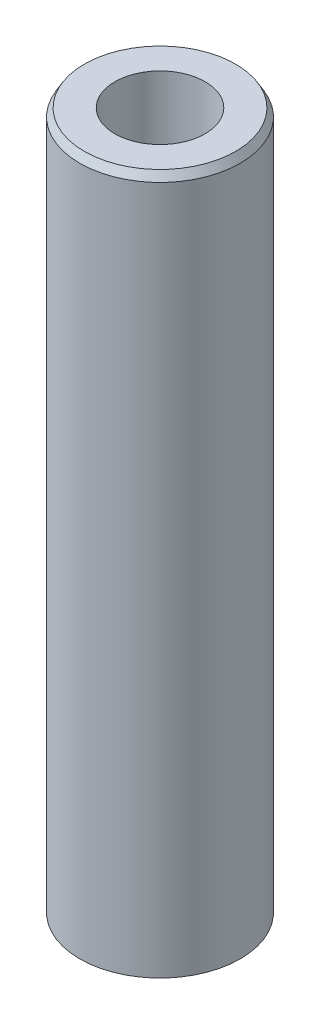
from build123d import *
from OCP.BRepFilletAPI import BRepFilletAPI_MakeChamfer

# Parameters (mm, degrees)
SKETCH1_R           = 40
BOSS_EXTRUDE1_DEPTH = 349.717740528
SKETCH2_R           = 22.499147369
CUT_EXTRUDE1_DEPTH  = 355.263317378
CHAMFER1_SIZE       = 3.978863537
CHAMFER1_SIZE2      = 2.297197934


with BuildPart() as part:
    # Sketch1 → Boss-Extrude1 (new body)
    with BuildSketch(Plane(origin=(0, 0, 0), x_dir=(1, 0, 0), z_dir=(0, 1, 0))):
        Circle(SKETCH1_R)
    extrude(amount=BOSS_EXTRUDE1_DEPTH)

    # Sketch2 → Cut-Extrude1 (cut, through all)
    with BuildSketch(Plane(origin=(0, 0, 0), x_dir=(1, 0, 0), z_dir=(0, 1, 0))):
        Circle(SKETCH2_R)
    extrude(amount=CUT_EXTRUDE1_DEPTH, mode=Mode.SUBTRACT)

    # Chamfer1: one chamfer whose edges measure the first distance from different faces: ONE call of the kernel's chamfer builder (chamfer() names one face for all edges)
    chamfer1_edges_1 = [part.edges().sort_by_distance(p)[0] for p in [
        (-40, 349.717740528, 0),
    ]]
    chamfer1_side_1 = [part.faces().sort_by_distance(p)[0] for p in [
        (-40, 174.858870264, 0),
    ]]
    chamfer1_edges_2 = [part.edges().sort_by_distance(p)[0] for p in [
        (-40, 0, 0),
    ]]
    chamfer1_side_2 = [part.faces().sort_by_distance(p)[0] for p in [
        (-38.86862915, 0, 0),
    ]]
    chamfer1 = BRepFilletAPI_MakeChamfer(part.part.solid().wrapped)
    for e in chamfer1_edges_1:
        chamfer1.Add(CHAMFER1_SIZE, CHAMFER1_SIZE2, e.wrapped, chamfer1_side_1[0].wrapped)  # the first distance lies on this face
    for e in chamfer1_edges_2:
        chamfer1.Add(CHAMFER1_SIZE, CHAMFER1_SIZE2, e.wrapped, chamfer1_side_2[0].wrapped)  # the first distance lies on this face
    add(Compound.cast(chamfer1.Shape()), mode=Mode.REPLACE)


solid = part.part
